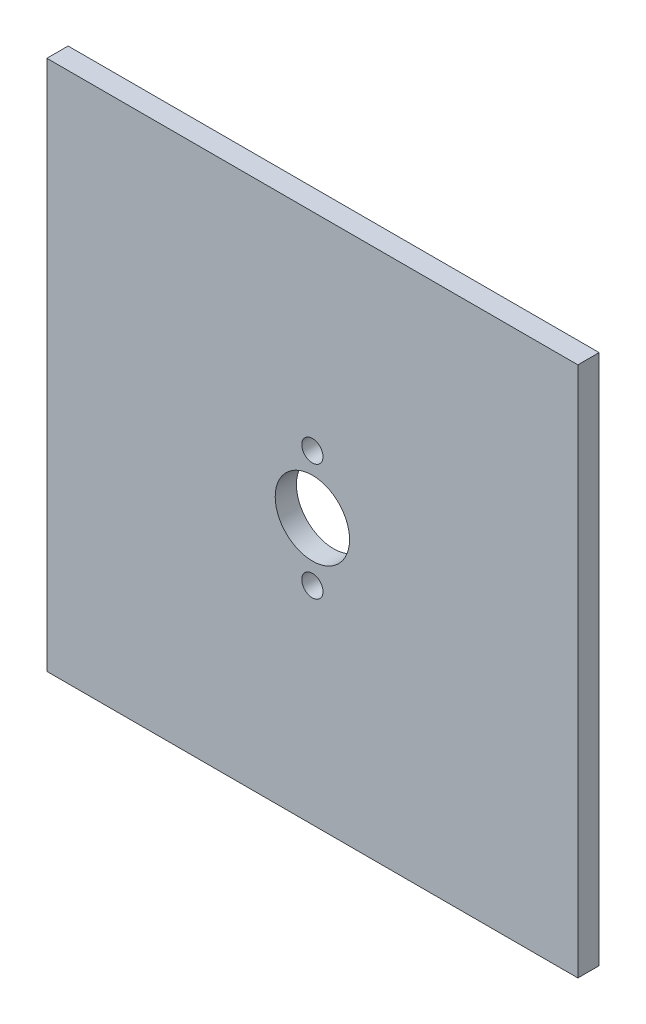
from build123d import *

# Parameters (mm, degrees)
SKETCH4_W           = 50
SKETCH4_H           = 50
BOSS_EXTRUDE2_DEPTH = 2
CUT_EXTRUDE1_REACH  = 72.739
SKETCH5_R           = 1
CUT_EXTRUDE2_REACH  = 72.739
SKETCH6_R           = 3.5


with BuildPart() as part:
    # Sketch4 → Boss-Extrude2 (new body)
    with BuildSketch(Plane.XY):
        with Locations((-25, 25)):
            Rectangle(SKETCH4_W, SKETCH4_H)
    extrude(amount=BOSS_EXTRUDE2_DEPTH)

    # Sketch5 → Cut-Extrude1 (cut, up to next)
    with BuildSketch(Plane.XY.offset(2), mode=Mode.PRIVATE) as cut_extrude1_sk1:
        with Locations((-25, 30.5)):
            Circle(SKETCH5_R)
    cut_extrude1_tool1 = extrude(cut_extrude1_sk1.sketch, amount=-CUT_EXTRUDE1_REACH, mode=Mode.PRIVATE) & part.part
    # Sketch5 → Cut-Extrude1 (cut, up to next)
    with BuildSketch(Plane.XY.offset(2), mode=Mode.PRIVATE) as cut_extrude1_sk2:
        with Locations((-25, 19.5)):
            Circle(SKETCH5_R)
    cut_extrude1_tool2 = extrude(cut_extrude1_sk2.sketch, amount=-CUT_EXTRUDE1_REACH, mode=Mode.PRIVATE) & part.part
    add(cut_extrude1_tool1.solids().sort_by_distance((-25, 30.5, 2))[0], mode=Mode.SUBTRACT)
    add(cut_extrude1_tool2.solids().sort_by_distance((-25, 19.5, 2))[0], mode=Mode.SUBTRACT)

    # Sketch6 → Cut-Extrude2 (cut, up to next)
    with BuildSketch(Plane(origin=(0, 0, 0), x_dir=(-1, 0, 0), z_dir=(0, 0, -1)), mode=Mode.PRIVATE) as cut_extrude2_sk1:
        with Locations((25, 25)):
            Circle(SKETCH6_R)
    cut_extrude2_tool1 = extrude(cut_extrude2_sk1.sketch, amount=-CUT_EXTRUDE2_REACH, mode=Mode.PRIVATE) & part.part
    add(cut_extrude2_tool1.solids().sort_by_distance((-25, 25, 0))[0], mode=Mode.SUBTRACT)


solid = part.part
